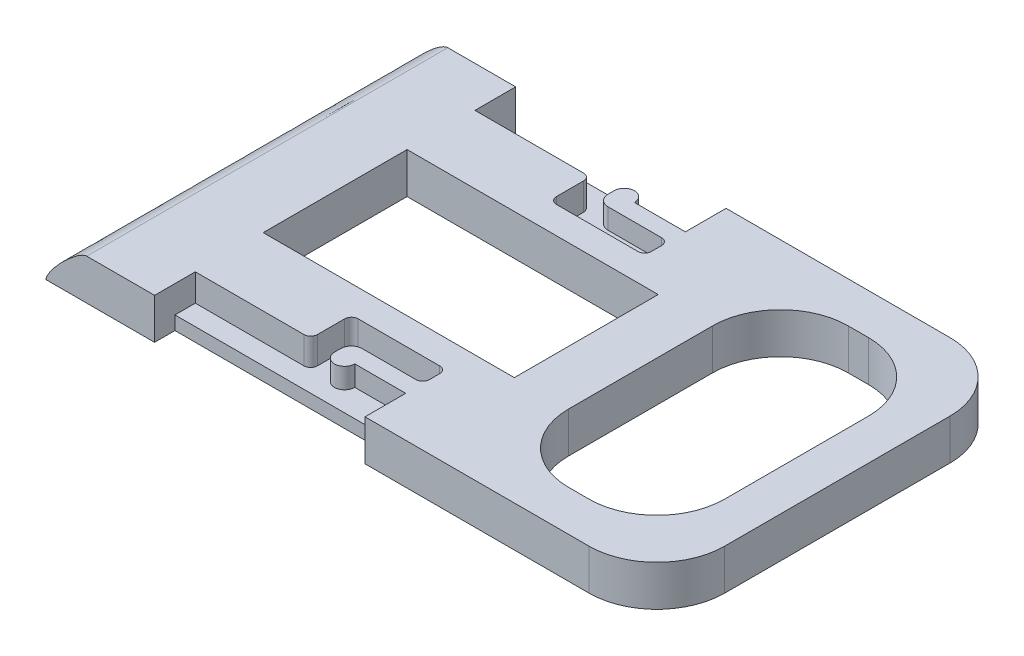
from build123d import *

# Parameters (mm, degrees)
SKETCH1_W                      = 45
SKETCH1_H                      = 26.6
BOSS_EXTRUDE1_DEPTH            = 3
SKETCH3_W                      = 15.5
SKETCH3_H                      = 3
CUT_EXTRUDE1_DEPTH             = 2
SKETCH4_W                      = 15.5
SKETCH4_H                      = 1.5
CUT_EXTRUDE2_DEPTH             = 53.312140082
FILLET1_SIZE                   = 3
BOSS_EXTRUDE2_REACH            = 54.36
SKETCH5_R                      = 0.75
SKETCH6_W                      = 18.5
SKETCH6_H                      = 10.6
CUT_EXTRUDE3_DEPTH             = 53.359908383
CUT_EXTRUDE4_DEPTH             = 2
CUT_EXTRUDE5_REACH             = 52.901
SKETCH8_W                      = 5.25
SKETCH8_H                      = 0.5
CUT_EXTRUDE5_DIRECTION_2_REACH = 52.901
CUT_EXTRUDE6_REACH             = 52.901
SKETCH9_W                      = 5.25
SKETCH9_H                      = 0.5
CUT_EXTRUDE6_DIRECTION_2_REACH = 52.901
FILLET2_R                      = 0.8
FILLET3_R                      = 5
SKETCH10_W                     = 11.5
SKETCH10_H                     = 20.6
CUT_EXTRUDE7_DEPTH             = 53.359908383
FILLET4_R                      = 5
FILLET5_R                      = 0.5


with BuildPart() as part:
    # Sketch1 → Boss-Extrude1 (new body)
    with BuildSketch(Plane(origin=(0, 0, 0), x_dir=(1, 0, 0), z_dir=(0, 1, 0))):
        with Locations((22.5, 13.3)):
            Rectangle(SKETCH1_W, SKETCH1_H)
    extrude(amount=BOSS_EXTRUDE1_DEPTH)

    # Sketch3 → Cut-Extrude1 (cut)
    with BuildSketch(Plane(origin=(0, 3, 0), x_dir=(1, 0, 0), z_dir=(0, 1, 0))):
        with Locations((15.75, 25.1)):
            Rectangle(SKETCH3_W, SKETCH3_H)
        with Locations((15.75, 1.5)):
            Rectangle(SKETCH3_W, SKETCH3_H)
    extrude(amount=-CUT_EXTRUDE1_DEPTH, mode=Mode.SUBTRACT)

    # Sketch4 → Cut-Extrude2 (cut, through all)
    with BuildSketch(Plane(origin=(0, 1, 0), x_dir=(1, 0, 0), z_dir=(0, 1, 0))):
        with Locations((15.75, 0.75)):
            Rectangle(SKETCH4_W, SKETCH4_H)
        with Locations((15.75, 25.85)):
            Rectangle(SKETCH4_W, SKETCH4_H)
    extrude(amount=-CUT_EXTRUDE2_DEPTH, mode=Mode.SUBTRACT)

    # Fillet1
    # a fillet whose section is not a circle: 3 mm, written as the material it takes off along each edge
    with BuildSketch(Plane(origin=(0, 3, -34.1), x_dir=(1, 0, 0), z_dir=(0, 0, 1))) as fillet1_piece_1:
        with BuildLine():
            Bezier((FILLET1_SIZE, 0), (0, 0), (0, -FILLET1_SIZE), weights=[1, 0.212132034, 1])
            Line((0, -FILLET1_SIZE), (0, 0))
            Line((0, 0), (FILLET1_SIZE, 0))
        make_face()
    extrude(amount=41.6, mode=Mode.SUBTRACT)

    # Sketch5 → Boss-Extrude2 (add, up to next)
    with BuildSketch(Plane(origin=(0, 3, 0), x_dir=(1, 0, 0), z_dir=(0, 1, 0)), mode=Mode.PRIVATE) as boss_extrude2_sk1:
        with Locations((19, 3)):
            Circle(SKETCH5_R)
    boss_extrude2_tool1 = extrude(boss_extrude2_sk1.sketch, amount=-BOSS_EXTRUDE2_REACH, mode=Mode.PRIVATE) - part.part
    # Sketch5 → Boss-Extrude2 (add, up to next)
    with BuildSketch(Plane(origin=(0, 3, 0), x_dir=(1, 0, 0), z_dir=(0, 1, 0)), mode=Mode.PRIVATE) as boss_extrude2_sk2:
        with Locations((19, 23.6)):
            Circle(SKETCH5_R)
    boss_extrude2_tool2 = extrude(boss_extrude2_sk2.sketch, amount=-BOSS_EXTRUDE2_REACH, mode=Mode.PRIVATE) - part.part
    add(boss_extrude2_tool1.solids().sort_by_distance((19, 3, -3))[0])
    add(boss_extrude2_tool2.solids().sort_by_distance((19, 3, -23.6))[0])

    # Sketch6 → Cut-Extrude3 (cut, through all)
    with BuildSketch(Plane(origin=(0, 3, 0), x_dir=(1, 0, 0), z_dir=(0, 1, 0))):
        with Locations((17.25, 13.3)):
            Rectangle(SKETCH6_W, SKETCH6_H)
    extrude(amount=-CUT_EXTRUDE3_DEPTH, mode=Mode.SUBTRACT)

    # Sketch7 → Cut-Extrude4 (cut)
    with BuildSketch(Plane(origin=(0, 3, 0), x_dir=(1, 0, 0), z_dir=(0, 1, 0))):
        Polygon((18.25, 3), (16.5, 3), (16.5, 6), (23.5, 6), (23.5, 4.25), (18.25, 4.25), align=None)
        Polygon((18.25, 22.35), (18.25, 23.6), (16.5, 23.6), (16.5, 20.6), (23.5, 20.6), (23.5, 22.35), align=None)
    extrude(amount=-CUT_EXTRUDE4_DEPTH, mode=Mode.SUBTRACT)

    # Sketch8 → Cut-Extrude5 (cut, up to next)
    with BuildSketch(Plane.XY.offset(-3), mode=Mode.PRIVATE) as cut_extrude5_sk1:
        with Locations((20.875, 1.25)):
            Rectangle(SKETCH8_W, SKETCH8_H)
    cut_extrude5_tool1 = extrude(cut_extrude5_sk1.sketch, amount=-CUT_EXTRUDE5_REACH, mode=Mode.PRIVATE) & part.part
    add(cut_extrude5_tool1.solids().sort_by_distance((20.875, 1.25, -3))[0], mode=Mode.SUBTRACT)

    # Sketch8 → Cut-Extrude5 direction 2 (cut, up to next)
    with BuildSketch(Plane.XY.offset(-3), mode=Mode.PRIVATE) as cut_extrude5_direction_2_sk1:
        with Locations((20.875, 1.25)):
            Rectangle(SKETCH8_W, SKETCH8_H)
    cut_extrude5_direction_2_tool1 = extrude(cut_extrude5_direction_2_sk1.sketch, amount=CUT_EXTRUDE5_DIRECTION_2_REACH, mode=Mode.PRIVATE) & part.part
    add(cut_extrude5_direction_2_tool1.solids().sort_by_distance((20.875, 1.25, -3))[0], mode=Mode.SUBTRACT)

    # Sketch9 → Cut-Extrude6 (cut, up to next)
    with BuildSketch(Plane(origin=(0, 0, -23.6), x_dir=(-1, 0, 0), z_dir=(0, 0, -1)), mode=Mode.PRIVATE) as cut_extrude6_sk1:
        with Locations((-20.875, 1.25)):
            Rectangle(SKETCH9_W, SKETCH9_H)
    cut_extrude6_tool1 = extrude(cut_extrude6_sk1.sketch, amount=-CUT_EXTRUDE6_REACH, mode=Mode.PRIVATE) & part.part
    add(cut_extrude6_tool1.solids().sort_by_distance((20.875, 1.25, -23.6))[0], mode=Mode.SUBTRACT)

    # Sketch9 → Cut-Extrude6 direction 2 (cut, up to next)
    with BuildSketch(Plane(origin=(0, 0, -23.6), x_dir=(-1, 0, 0), z_dir=(0, 0, -1)), mode=Mode.PRIVATE) as cut_extrude6_direction_2_sk1:
        with Locations((-20.875, 1.25)):
            Rectangle(SKETCH9_W, SKETCH9_H)
    cut_extrude6_direction_2_tool1 = extrude(cut_extrude6_direction_2_sk1.sketch, amount=CUT_EXTRUDE6_DIRECTION_2_REACH, mode=Mode.PRIVATE) & part.part
    add(cut_extrude6_direction_2_tool1.solids().sort_by_distance((20.875, 1.25, -23.6))[0], mode=Mode.SUBTRACT)

    # Fillet2
    fillet2_edges = [part.edges().sort_by_distance(p)[0] for p in [
        (18.25, 2.25, -4.25),
        (18.25, 2.25, -22.35),
    ]]
    fillet(fillet2_edges, radius=FILLET2_R)

    # Fillet3
    fillet3_edges = [part.edges().sort_by_distance(p)[0] for p in [
        (45, 1.5, -26.6),
        (45, 1.5, 0),
    ]]
    fillet(fillet3_edges, radius=FILLET3_R)

    # Sketch10 → Cut-Extrude7 (cut, through all)
    with BuildSketch(Plane(origin=(0, 3, 0), x_dir=(1, 0, 0), z_dir=(0, 1, 0))):
        with Locations((36.25, 13.3)):
            Rectangle(SKETCH10_W, SKETCH10_H)
    extrude(amount=-CUT_EXTRUDE7_DEPTH, mode=Mode.SUBTRACT)

    # Fillet4
    fillet4_edges = [part.edges().sort_by_distance(p)[0] for p in [
        (42, 1.5, -23.6),
        (42, 1.5, -3),
        (30.5, 1.5, -3),
        (30.5, 1.5, -23.6),
    ]]
    fillet(fillet4_edges, radius=FILLET4_R)

    # Fillet5
    fillet5_edges = [part.edges().sort_by_distance(p)[0] for p in [
        (23.5, 2, -6),
        (16.5, 2, -6),
        (16.5, 2, -3),
        (16.5, 2, -23.6),
        (16.5, 2, -20.6),
        (23.5, 2, -20.6),
        (23.5, 2.25, -4.25),
        (23.5, 2.25, -22.35),
    ]]
    fillet(fillet5_edges, radius=FILLET5_R)


solid = part.part
